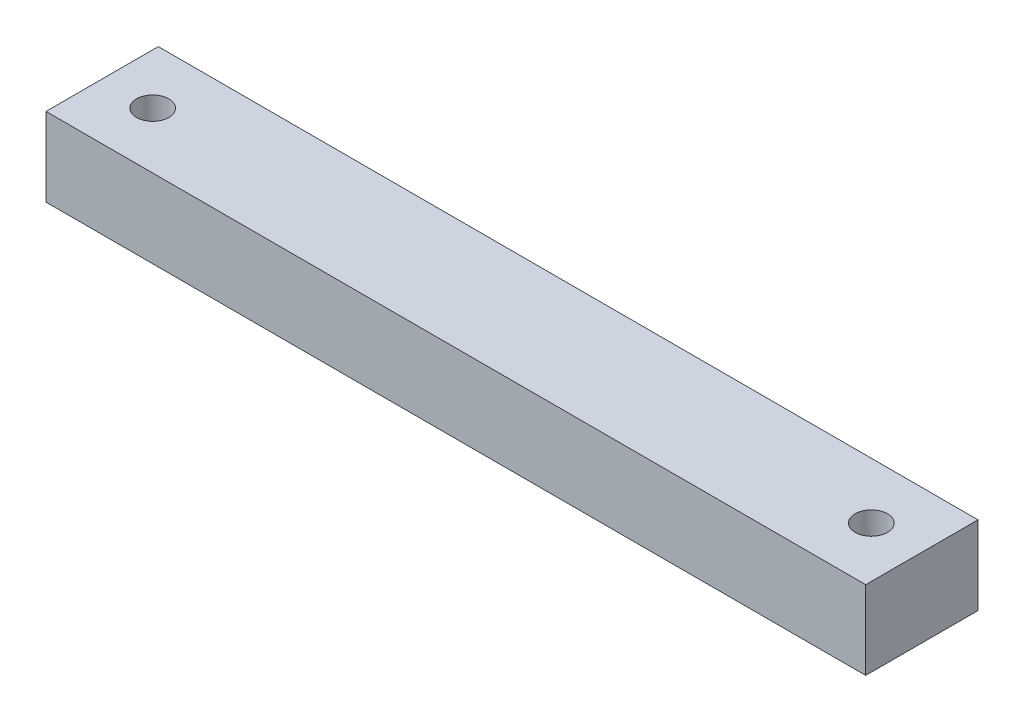
from build123d import *

# Parameters (mm, degrees)
SKETCH1_W                   = 92.71
SKETCH1_H                   = 12.7
BOSS_EXTRUDE1_DEPTH         = 8.89
F_27_0_144_DIAMETER_HOLE1_D = 3.6576


with BuildPart() as part:
    # Sketch1 → Boss-Extrude1 (new body)
    with BuildSketch(Plane(origin=(0, 0, 0), x_dir=(1, 0, 0), z_dir=(0, 1, 0))):
        with Locations((46.355, -6.35)):
            Rectangle(SKETCH1_W, SKETCH1_H)
    extrude(amount=BOSS_EXTRUDE1_DEPTH)

    # #27 (0.144) Diameter Hole1 (through all)
    with Locations(Plane(origin=(0, 8.89, 0), x_dir=(1, 0, 0), z_dir=(0, 1, 0))):
        with Locations((5.715, -6.35), (86.995, -6.35)):
            Hole(F_27_0_144_DIAMETER_HOLE1_D / 2)


solid = part.part
